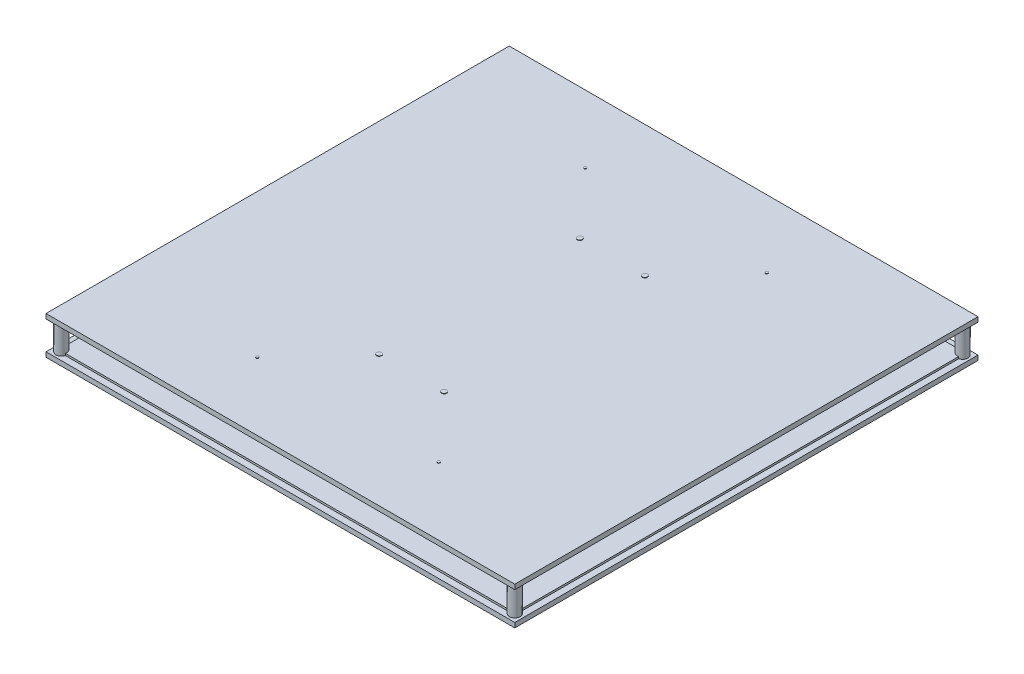
from build123d import *

# Parameters (mm, degrees)
SKETCH1_W           = 310.792155558
SKETCH1_H           = 307.10414309
BOSS_EXTRUDE1_DEPTH = 3.175
SKETCH2_W           = 302.308555558
SKETCH2_H           = 298.62054309
BOSS_EXTRUDE2_DEPTH = 1.27
BOSS_EXTRUDE4_DEPTH = 3.175
SKETCH6_R           = 0.911045746
SKETCH6_R_2         = 1.683740392
BOSS_EXTRUDE7_DEPTH = 0.254
SKETCH7_R           = 3.556
BOSS_EXTRUDE8_DEPTH = 23.876


with BuildPart() as part:
    # Sketch1 → Boss-Extrude1 (new body)
    with BuildSketch(Plane(origin=(0, 0, 0), x_dir=(1, 0, 0), z_dir=(0, 1, 0))):
        Rectangle(SKETCH1_W, SKETCH1_H)
    extrude(amount=BOSS_EXTRUDE1_DEPTH)

    # Sketch2 → Boss-Extrude2 (add)
    with BuildSketch(Plane(origin=(0, 3.175, 0), x_dir=(1, 0, 0), z_dir=(0, 1, 0))):
        Rectangle(SKETCH2_W, SKETCH2_H)
    extrude(amount=BOSS_EXTRUDE2_DEPTH)



with BuildPart() as body_2:
    # 3DSketch1 → Boss-Extrude4 (new body)
    with BuildSketch(Plane(origin=(-155.396077779, 25.1714, -153.552071545), x_dir=(0.7113145904869971, 0, 0.7028737819554204), z_dir=(0, -1, 0))):
        Polygon((0, 0), (215.855450508, 218.447657779), (436.926445365, 0), (221.070994857, -218.447657779), align=None)
    extrude(amount=BOSS_EXTRUDE4_DEPTH)

    # Sketch6 → Boss-Extrude7 (add)
    with BuildSketch(Plane(origin=(0, 25.1714, 0), x_dir=(1, 0, 0), z_dir=(0, 1, 0))):
        with Locations((60.146077779, 108.71629912)):
            Circle(SKETCH6_R)
        with Locations((21.538077779, 66.55229912)):
            Circle(SKETCH6_R_2)
        with Locations((-21.538077779, 66.55229912)):
            Circle(SKETCH6_R_2)
        with Locations((-60.146077779, 108.71629912)):
            Circle(SKETCH6_R)
        with Locations((21.538077779, -66.55229912)):
            Circle(SKETCH6_R_2)
        with Locations((60.146077779, -108.71629912)):
            Circle(SKETCH6_R)
        with Locations((-21.538077779, -66.55229912)):
            Circle(SKETCH6_R_2)
        with Locations((-60.146077779, -108.71629912)):
            Circle(SKETCH6_R)
    extrude(amount=BOSS_EXTRUDE7_DEPTH)


with BuildPart() as part_1:
    add(part.part)

    add(body_2.part)  # Boss-Extrude8 merges body 2
    # Sketch7 → Boss-Extrude8 (add)
    with BuildSketch(Plane.XZ):
        with Locations((-150.316077779, 148.472071545)):
            Circle(SKETCH7_R)
        with Locations((150.316077779, 148.472071545)):
            Circle(SKETCH7_R)
        with Locations((150.316077779, -148.472071545)):
            Circle(SKETCH7_R)
        with Locations((-150.316077779, -148.472071545)):
            Circle(SKETCH7_R)
    extrude(amount=-BOSS_EXTRUDE8_DEPTH)


solid = part_1.part
